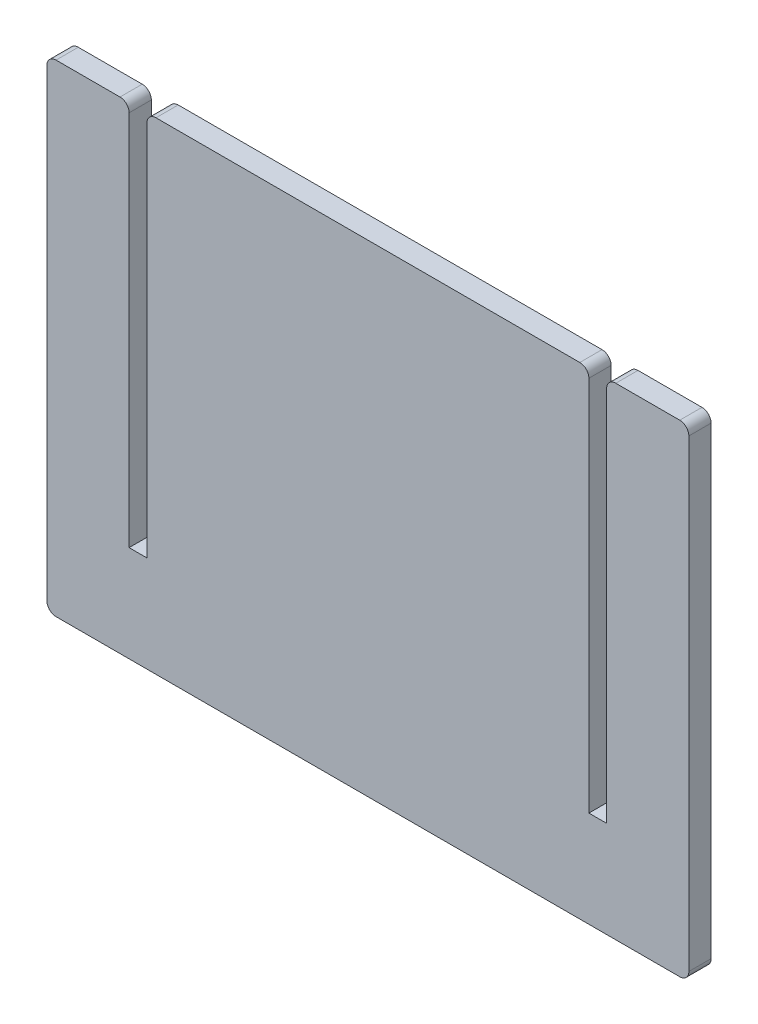
from build123d import *

# Parameters (mm, degrees)
BOSS_EXTRUDE1_DEPTH = 3.175
FILLET5_R           = 1.27
SHELL2_START        = -0.1778
SHELL2_OUTLINE_W    = 75.8444
SHELL2_OUTLINE_H    = 3.5306
SHELL2_DEPTH        = 0.1778
SHELL2_START_2      = 14.942805851
SHELL2_2_OUTLINE_W  = 2.8194
SHELL2_2_OUTLINE_H  = 3.5306
SHELL2_2_DEPTH      = 0.1778
SHELL2_3_DEPTH      = 3.175
SHELL2_4_DEPTH      = 0.1778
SHELL2_START_3      = 3.175
SHELL2_5_DEPTH      = 0.1778
SHELL2_6_DEPTH      = 3.5306


with BuildPart() as part:
    # Sketch1 → Boss-Extrude1 (new body)
    with BuildSketch(Plane.XY):
        Polygon((50.8, 0), (50.8, 76.2), (15.875, 76.2), (15.875, 14.942805851), (12.7, 14.942805851), (12.7, 76.2), (0, 76.2), (0, 0), align=None)
        Polygon((85.725, 76.2), (50.8, 76.2), (50.8, 0), (101.6, 0), (101.6, 76.2), (88.9, 76.2), (88.9, 14.942805851), (85.725, 14.942805851), align=None)
    extrude(amount=BOSS_EXTRUDE1_DEPTH)

    # Fillet5
    fillet5_edges = [part.edges().sort_by_distance(p)[0] for p in [
        (0, 0, 1.5875),
        (0, 76.2, 1.5875),
        (12.7, 76.2, 1.5875),
        (15.875, 76.2, 1.5875),
        (85.725, 76.2, 1.5875),
        (88.9, 76.2, 1.5875),
        (101.6, 76.2, 1.5875),
        (101.6, 0, 1.5875),
    ]]
    fillet(fillet5_edges, radius=FILLET5_R)

    # Shell2: read off the stored shape, not the designer's step
    # Shell2 outline → Shell2 (add)
    with BuildSketch(Plane(origin=(0, 0, 0), x_dir=(1, 0, 0), z_dir=(0, 1, 0)).offset(SHELL2_START)):
        with Locations((50.8, -1.5875)):
            Rectangle(SHELL2_OUTLINE_W, SHELL2_OUTLINE_H)
    extrude(amount=SHELL2_DEPTH)

    # Shell2 2 outline → Shell2 2 (add)
    with BuildSketch(Plane(origin=(0, 0, 0), x_dir=(1, 0, 0), z_dir=(0, 1, 0)).offset(SHELL2_START_2)):
        with Locations((87.3125, -1.5875)):
            Rectangle(SHELL2_2_OUTLINE_W, SHELL2_2_OUTLINE_H)
        with Locations((14.2875, -1.5875)):
            Rectangle(SHELL2_2_OUTLINE_W, SHELL2_2_OUTLINE_H)
    extrude(amount=SHELL2_2_DEPTH)

    # Shell2 3 outline → Shell2 3 (cut)
    with BuildSketch(Plane.XY):
        with BuildLine():
            Line((1.27, 0), (100.33, 0))
            ThreePointArc((100.33, 0), (101.228025612, 0.371974388), (101.6, 1.27))
            Line((101.6, 1.27), (101.6, 74.93))
            ThreePointArc((101.6, 74.93), (101.228025612, 75.828025612), (100.33, 76.2))
            Line((100.33, 76.2), (90.17, 76.2))
            ThreePointArc((90.17, 76.2), (89.271974388, 75.828025612), (88.9, 74.93))
            Line((88.9, 74.93), (88.9, 14.942805851))
            Line((88.9, 14.942805851), (85.725, 14.942805851))
            Line((85.725, 14.942805851), (85.725, 74.93))
            ThreePointArc((85.725, 74.93), (85.353025612, 75.828025612), (84.455, 76.2))
            Line((84.455, 76.2), (17.145, 76.2))
            ThreePointArc((17.145, 76.2), (16.246974388, 75.828025612), (15.875, 74.93))
            Line((15.875, 74.93), (15.875, 14.942805851))
            Line((15.875, 14.942805851), (12.7, 14.942805851))
            Line((12.7, 14.942805851), (12.7, 74.93))
            ThreePointArc((12.7, 74.93), (12.328025612, 75.828025612), (11.43, 76.2))
            Line((11.43, 76.2), (1.27, 76.2))
            ThreePointArc((1.27, 76.2), (0.371974388, 75.828025612), (0, 74.93))
            Line((0, 74.93), (0, 1.27))
            ThreePointArc((0, 1.27), (0.371974388, 0.371974388), (1.27, 0))
        make_face()
    extrude(amount=SHELL2_3_DEPTH, mode=Mode.SUBTRACT)

    # Shell2 4 outline → Shell2 4 (add)
    with BuildSketch(Plane.XY.offset(SHELL2_START)):
        with BuildLine():
            Line((88.7222, -0.1778), (100.33, -0.1778))
            ThreePointArc((100.33, -0.1778), (101.353749198, 0.246250802), (101.7778, 1.27))
            Line((101.7778, 1.27), (101.7778, 74.93))
            ThreePointArc((101.7778, 74.93), (101.353749198, 75.953749198), (100.33, 76.3778))
            Line((100.33, 76.3778), (90.17, 76.3778))
            ThreePointArc((90.17, 76.3778), (89.146250802, 75.953749198), (88.7222, 74.93))
            Line((88.7222, 74.93), (88.7222, 14.942805851))
            Line((88.7222, 14.942805851), (85.9028, 14.942805851))
            Line((85.9028, 14.942805851), (85.9028, 74.93))
            ThreePointArc((85.9028, 74.93), (85.478749198, 75.953749198), (84.455, 76.3778))
            Line((84.455, 76.3778), (17.145, 76.3778))
            ThreePointArc((17.145, 76.3778), (16.121250802, 75.953749198), (15.6972, 74.93))
            Line((15.6972, 74.93), (15.6972, 14.942805851))
            Line((15.6972, 14.942805851), (12.8778, 14.942805851))
            Line((12.8778, 14.942805851), (12.8778, 74.93))
            ThreePointArc((12.8778, 74.93), (12.453749198, 75.953749198), (11.43, 76.3778))
            Line((11.43, 76.3778), (1.27, 76.3778))
            ThreePointArc((1.27, 76.3778), (0.246250802, 75.953749198), (-0.1778, 74.93))
            Line((-0.1778, 74.93), (-0.1778, 1.27))
            ThreePointArc((-0.1778, 1.27), (0.246250802, 0.246250802), (1.27, -0.1778))
            Line((1.27, -0.1778), (12.8778, -0.1778))
            Line((12.8778, -0.1778), (12.8778, 0))
            Line((12.8778, 0), (88.7222, 0))
            Line((88.7222, 0), (88.7222, -0.1778))
        make_face()
    extrude(amount=SHELL2_4_DEPTH)

    # Shell2 5 outline → Shell2 5 (add)
    with BuildSketch(Plane.XY.offset(SHELL2_START_3)):
        with BuildLine():
            Line((88.7222, -0.1778), (100.33, -0.1778))
            ThreePointArc((100.33, -0.1778), (101.353749198, 0.246250802), (101.7778, 1.27))
            Line((101.7778, 1.27), (101.7778, 74.93))
            ThreePointArc((101.7778, 74.93), (101.353749198, 75.953749198), (100.33, 76.3778))
            Line((100.33, 76.3778), (90.17, 76.3778))
            ThreePointArc((90.17, 76.3778), (89.146250802, 75.953749198), (88.7222, 74.93))
            Line((88.7222, 74.93), (88.7222, 14.942805851))
            Line((88.7222, 14.942805851), (85.9028, 14.942805851))
            Line((85.9028, 14.942805851), (85.9028, 74.93))
            ThreePointArc((85.9028, 74.93), (85.478749198, 75.953749198), (84.455, 76.3778))
            Line((84.455, 76.3778), (17.145, 76.3778))
            ThreePointArc((17.145, 76.3778), (16.121250802, 75.953749198), (15.6972, 74.93))
            Line((15.6972, 74.93), (15.6972, 14.942805851))
            Line((15.6972, 14.942805851), (12.8778, 14.942805851))
            Line((12.8778, 14.942805851), (12.8778, 74.93))
            ThreePointArc((12.8778, 74.93), (12.453749198, 75.953749198), (11.43, 76.3778))
            Line((11.43, 76.3778), (1.27, 76.3778))
            ThreePointArc((1.27, 76.3778), (0.246250802, 75.953749198), (-0.1778, 74.93))
            Line((-0.1778, 74.93), (-0.1778, 1.27))
            ThreePointArc((-0.1778, 1.27), (0.246250802, 0.246250802), (1.27, -0.1778))
            Line((1.27, -0.1778), (12.8778, -0.1778))
            Line((12.8778, -0.1778), (12.8778, 0))
            Line((12.8778, 0), (88.7222, 0))
            Line((88.7222, 0), (88.7222, -0.1778))
        make_face()
    extrude(amount=SHELL2_5_DEPTH)

    # Shell2 6 outline → Shell2 6 (add)
    with BuildSketch(Plane.XY.offset(SHELL2_START)):
        with BuildLine():
            Line((88.7222, -0.1778), (100.33, -0.1778))
            ThreePointArc((100.33, -0.1778), (101.353749198, 0.246250802), (101.7778, 1.27))
            Line((101.7778, 1.27), (101.7778, 74.93))
            ThreePointArc((101.7778, 74.93), (101.353749198, 75.953749198), (100.33, 76.3778))
            Line((100.33, 76.3778), (90.17, 76.3778))
            ThreePointArc((90.17, 76.3778), (89.146250802, 75.953749198), (88.7222, 74.93))
            Line((88.7222, 74.93), (88.7222, 14.942805851))
            Line((88.7222, 14.942805851), (88.9, 14.942805851))
            Line((88.9, 14.942805851), (88.9, 74.93))
            ThreePointArc((88.9, 74.93), (89.271974388, 75.828025612), (90.17, 76.2))
            Line((90.17, 76.2), (100.33, 76.2))
            ThreePointArc((100.33, 76.2), (101.228025612, 75.828025612), (101.6, 74.93))
            Line((101.6, 74.93), (101.6, 1.27))
            ThreePointArc((101.6, 1.27), (101.228025612, 0.371974388), (100.33, 0))
            Line((100.33, 0), (88.7222, 0))
            Line((88.7222, 0), (88.7222, -0.1778))
        make_face()
        with BuildLine():
            Line((1.27, -0.1778), (12.8778, -0.1778))
            Line((12.8778, -0.1778), (12.8778, 0))
            Line((12.8778, 0), (1.27, 0))
            ThreePointArc((1.27, 0), (0.371974388, 0.371974388), (0, 1.27))
            Line((0, 1.27), (0, 74.93))
            ThreePointArc((0, 74.93), (0.371974388, 75.828025612), (1.27, 76.2))
            Line((1.27, 76.2), (11.43, 76.2))
            ThreePointArc((11.43, 76.2), (12.328025612, 75.828025612), (12.7, 74.93))
            Line((12.7, 74.93), (12.7, 14.942805851))
            Line((12.7, 14.942805851), (12.8778, 14.942805851))
            Line((12.8778, 14.942805851), (12.8778, 74.93))
            ThreePointArc((12.8778, 74.93), (12.453749198, 75.953749198), (11.43, 76.3778))
            Line((11.43, 76.3778), (1.27, 76.3778))
            ThreePointArc((1.27, 76.3778), (0.246250802, 75.953749198), (-0.1778, 74.93))
            Line((-0.1778, 74.93), (-0.1778, 1.27))
            ThreePointArc((-0.1778, 1.27), (0.246250802, 0.246250802), (1.27, -0.1778))
        make_face()
        with BuildLine():
            Line((85.725, 14.942805851), (85.9028, 14.942805851))
            Line((85.9028, 14.942805851), (85.9028, 74.93))
            ThreePointArc((85.9028, 74.93), (85.478749198, 75.953749198), (84.455, 76.3778))
            Line((84.455, 76.3778), (17.145, 76.3778))
            ThreePointArc((17.145, 76.3778), (16.121250802, 75.953749198), (15.6972, 74.93))
            Line((15.6972, 74.93), (15.6972, 14.942805851))
            Line((15.6972, 14.942805851), (15.875, 14.942805851))
            Line((15.875, 14.942805851), (15.875, 74.93))
            ThreePointArc((15.875, 74.93), (16.246974388, 75.828025612), (17.145, 76.2))
            Line((17.145, 76.2), (84.455, 76.2))
            ThreePointArc((84.455, 76.2), (85.353025612, 75.828025612), (85.725, 74.93))
            Line((85.725, 74.93), (85.725, 14.942805851))
        make_face()
    extrude(amount=SHELL2_6_DEPTH)


solid = part.part
